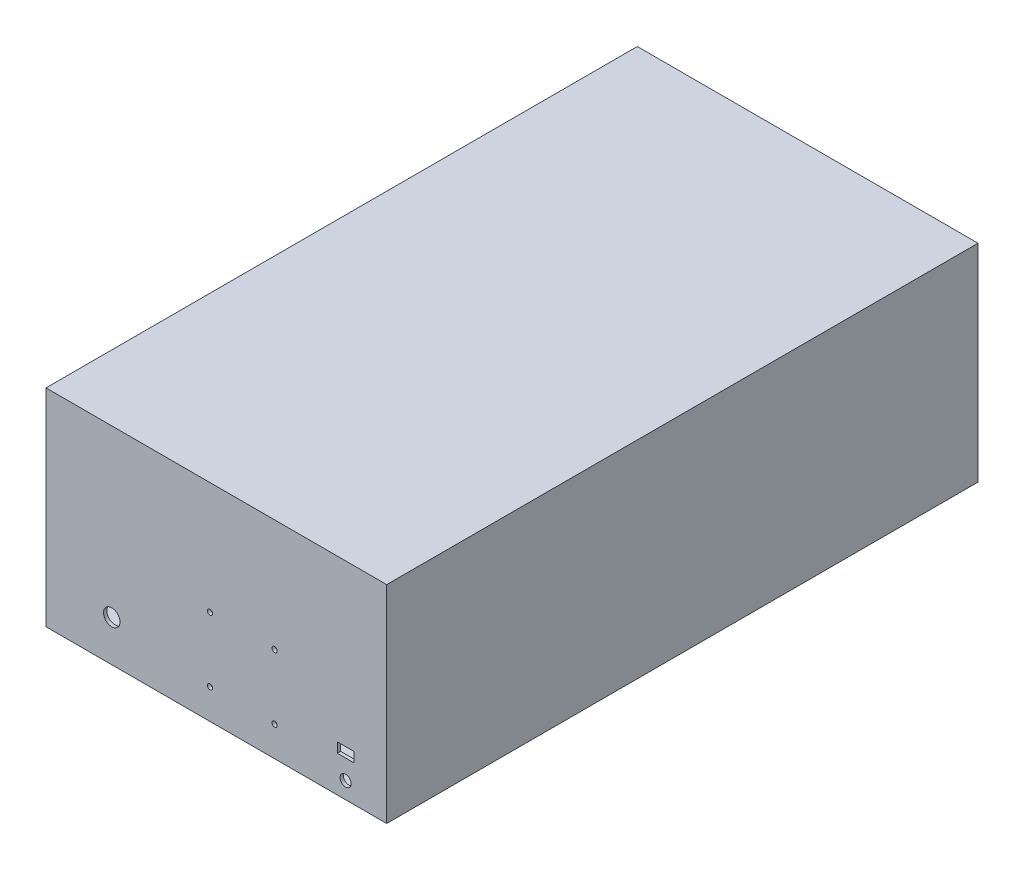
from build123d import *

# Parameters (mm, degrees)
SKETCH2_W               = 207.2
SKETCH2_H               = 359.6
SKETCH2_W_2             = 203.2
SKETCH2_H_2             = 355.6
WALLS_DEPTH             = 123.825
SKETCH3_W               = 207.2
SKETCH3_H               = 359.6
BASE_DEPTH              = 2
SKETCH4_R               = 5
SKETCH4_W               = 10
SKETCH4_H               = 6
CUT_EXTRUDE1_DEPTH      = 395.179845534
SKETCH5_R               = 3.3782
CUT_EXTRUDE2_DEPTH      = 395.179845534
F_1_4_CLEARANCE_HOLE1_D = 6.7564
CUT_EXTRUDE3_REACH      = 244.679
SKETCH9_R               = 1.6
CUT_EXTRUDE4_REACH      = 396.18
SKETCH10_R              = 1.6
SKETCH11_W              = 207.2
SKETCH11_H              = 359.6
BOSS_EXTRUDE1_DEPTH     = 10


with BuildPart() as part:
    # Sketch2 → Walls (new body)
    with BuildSketch(Plane(origin=(0, 0, 0), x_dir=(1, 0, 0), z_dir=(0, 1, 0))):
        Rectangle(SKETCH2_W, SKETCH2_H)
        Rectangle(SKETCH2_W_2, SKETCH2_H_2, mode=Mode.SUBTRACT)
    extrude(amount=WALLS_DEPTH)

    # Sketch3 → Base (add)
    with BuildSketch(Plane.XZ):
        Rectangle(SKETCH3_W, SKETCH3_H)
    extrude(amount=BASE_DEPTH)

    # Sketch4 → Cut-Extrude1 (cut, through all)
    with BuildSketch(Plane(origin=(0, 0, -179.8), x_dir=(-1, 0, 0), z_dir=(0, 0, -1))):
        with Locations((63.6, 23)):
            Circle(SKETCH4_R)
        with Locations((-78.6, 23)):
            Rectangle(SKETCH4_W, SKETCH4_H)
    extrude(amount=-CUT_EXTRUDE1_DEPTH, mode=Mode.SUBTRACT)

    # Sketch5 → Cut-Extrude2 (cut, through all)
    with BuildSketch(Plane(origin=(0, 0, -179.8), x_dir=(-1, 0, 0), z_dir=(0, 0, -1))):
        with Locations((-78.6, 8.09625)):
            Circle(SKETCH5_R)
    extrude(amount=-CUT_EXTRUDE2_DEPTH, mode=Mode.SUBTRACT)

    # 1/4 Clearance Hole1 (through all)
    with Locations(Plane(origin=(0, -2, 0), x_dir=(-1, 0, 0), z_dir=(0, -1, 0))):
        with Locations((-27, 0), (-5, 0)):
            Hole(F_1_4_CLEARANCE_HOLE1_D / 2)

    # Sketch9 → Cut-Extrude3 (cut, up to next)
    with BuildSketch(Plane.XZ.offset(2), mode=Mode.PRIVATE) as cut_extrude3_sk1:
        with Locations((92, 61.675)):
            Circle(SKETCH9_R)
    cut_extrude3_tool1 = extrude(cut_extrude3_sk1.sketch, amount=-CUT_EXTRUDE3_REACH, mode=Mode.PRIVATE) & part.part
    # Sketch9 → Cut-Extrude3 (cut, up to next)
    with BuildSketch(Plane.XZ.offset(2), mode=Mode.PRIVATE) as cut_extrude3_sk2:
        with Locations((92, -61.675)):
            Circle(SKETCH9_R)
    cut_extrude3_tool2 = extrude(cut_extrude3_sk2.sketch, amount=-CUT_EXTRUDE3_REACH, mode=Mode.PRIVATE) & part.part
    # Sketch9 → Cut-Extrude3 (cut, up to next)
    with BuildSketch(Plane.XZ.offset(2), mode=Mode.PRIVATE) as cut_extrude3_sk3:
        with Locations((49, 61.675)):
            Circle(SKETCH9_R)
    cut_extrude3_tool3 = extrude(cut_extrude3_sk3.sketch, amount=-CUT_EXTRUDE3_REACH, mode=Mode.PRIVATE) & part.part
    # Sketch9 → Cut-Extrude3 (cut, up to next)
    with BuildSketch(Plane.XZ.offset(2), mode=Mode.PRIVATE) as cut_extrude3_sk4:
        with Locations((49, -61.675)):
            Circle(SKETCH9_R)
    cut_extrude3_tool4 = extrude(cut_extrude3_sk4.sketch, amount=-CUT_EXTRUDE3_REACH, mode=Mode.PRIVATE) & part.part
    # Sketch9 → Cut-Extrude3 (cut, up to next)
    with BuildSketch(Plane.XZ.offset(2), mode=Mode.PRIVATE) as cut_extrude3_sk5:
        with Locations((27.150599532, -126.77942842)):
            Circle(SKETCH9_R)
    cut_extrude3_tool5 = extrude(cut_extrude3_sk5.sketch, amount=-CUT_EXTRUDE3_REACH, mode=Mode.PRIVATE) & part.part
    # Sketch9 → Cut-Extrude3 (cut, up to next)
    with BuildSketch(Plane.XZ.offset(2), mode=Mode.PRIVATE) as cut_extrude3_sk6:
        with Locations((27.150599532, -166.07942842)):
            Circle(SKETCH9_R)
    cut_extrude3_tool6 = extrude(cut_extrude3_sk6.sketch, amount=-CUT_EXTRUDE3_REACH, mode=Mode.PRIVATE) & part.part
    # Sketch9 → Cut-Extrude3 (cut, up to next)
    with BuildSketch(Plane.XZ.offset(2), mode=Mode.PRIVATE) as cut_extrude3_sk7:
        with Locations((-12.149400468, -126.77942842)):
            Circle(SKETCH9_R)
    cut_extrude3_tool7 = extrude(cut_extrude3_sk7.sketch, amount=-CUT_EXTRUDE3_REACH, mode=Mode.PRIVATE) & part.part
    # Sketch9 → Cut-Extrude3 (cut, up to next)
    with BuildSketch(Plane.XZ.offset(2), mode=Mode.PRIVATE) as cut_extrude3_sk8:
        with Locations((-12.149400468, -166.07942842)):
            Circle(SKETCH9_R)
    cut_extrude3_tool8 = extrude(cut_extrude3_sk8.sketch, amount=-CUT_EXTRUDE3_REACH, mode=Mode.PRIVATE) & part.part
    # Sketch9 → Cut-Extrude3 (cut, up to next)
    with BuildSketch(Plane.XZ.offset(2), mode=Mode.PRIVATE) as cut_extrude3_sk9:
        with Locations((23.972842929, -62.905516645)):
            Circle(SKETCH9_R)
    cut_extrude3_tool9 = extrude(cut_extrude3_sk9.sketch, amount=-CUT_EXTRUDE3_REACH, mode=Mode.PRIVATE) & part.part
    # Sketch9 → Cut-Extrude3 (cut, up to next)
    with BuildSketch(Plane.XZ.offset(2), mode=Mode.PRIVATE) as cut_extrude3_sk10:
        with Locations((23.972842929, -83.205516645)):
            Circle(SKETCH9_R)
    cut_extrude3_tool10 = extrude(cut_extrude3_sk10.sketch, amount=-CUT_EXTRUDE3_REACH, mode=Mode.PRIVATE) & part.part
    # Sketch9 → Cut-Extrude3 (cut, up to next)
    with BuildSketch(Plane.XZ.offset(2), mode=Mode.PRIVATE) as cut_extrude3_sk11:
        with Locations((3.672842929, -62.905516645)):
            Circle(SKETCH9_R)
    cut_extrude3_tool11 = extrude(cut_extrude3_sk11.sketch, amount=-CUT_EXTRUDE3_REACH, mode=Mode.PRIVATE) & part.part
    # Sketch9 → Cut-Extrude3 (cut, up to next)
    with BuildSketch(Plane.XZ.offset(2), mode=Mode.PRIVATE) as cut_extrude3_sk12:
        with Locations((3.672842929, -83.205516645)):
            Circle(SKETCH9_R)
    cut_extrude3_tool12 = extrude(cut_extrude3_sk12.sketch, amount=-CUT_EXTRUDE3_REACH, mode=Mode.PRIVATE) & part.part
    # Sketch9 → Cut-Extrude3 (cut, up to next)
    with BuildSketch(Plane.XZ.offset(2), mode=Mode.PRIVATE) as cut_extrude3_sk13:
        with Locations((-12.790807995, 29.507114508)):
            Circle(SKETCH9_R)
    cut_extrude3_tool13 = extrude(cut_extrude3_sk13.sketch, amount=-CUT_EXTRUDE3_REACH, mode=Mode.PRIVATE) & part.part
    # Sketch9 → Cut-Extrude3 (cut, up to next)
    with BuildSketch(Plane.XZ.offset(2), mode=Mode.PRIVATE) as cut_extrude3_sk14:
        with Locations((-12.790807995, -28.492885492)):
            Circle(SKETCH9_R)
    cut_extrude3_tool14 = extrude(cut_extrude3_sk14.sketch, amount=-CUT_EXTRUDE3_REACH, mode=Mode.PRIVATE) & part.part
    # Sketch9 → Cut-Extrude3 (cut, up to next)
    with BuildSketch(Plane.XZ.offset(2), mode=Mode.PRIVATE) as cut_extrude3_sk15:
        with Locations((-61.790807995, -28.492885492)):
            Circle(SKETCH9_R)
    cut_extrude3_tool15 = extrude(cut_extrude3_sk15.sketch, amount=-CUT_EXTRUDE3_REACH, mode=Mode.PRIVATE) & part.part
    # Sketch9 → Cut-Extrude3 (cut, up to next)
    with BuildSketch(Plane.XZ.offset(2), mode=Mode.PRIVATE) as cut_extrude3_sk16:
        with Locations((-61.790807995, 29.507114508)):
            Circle(SKETCH9_R)
    cut_extrude3_tool16 = extrude(cut_extrude3_sk16.sketch, amount=-CUT_EXTRUDE3_REACH, mode=Mode.PRIVATE) & part.part
    # Sketch9 → Cut-Extrude3 (cut, up to next)
    with BuildSketch(Plane.XZ.offset(2), mode=Mode.PRIVATE) as cut_extrude3_sk17:
        with Locations((-51.497087804, 74.997613979)):
            Circle(SKETCH9_R)
    cut_extrude3_tool17 = extrude(cut_extrude3_sk17.sketch, amount=-CUT_EXTRUDE3_REACH, mode=Mode.PRIVATE) & part.part
    # Sketch9 → Cut-Extrude3 (cut, up to next)
    with BuildSketch(Plane.XZ.offset(2), mode=Mode.PRIVATE) as cut_extrude3_sk18:
        with Locations((-12.197087804, 74.997613979)):
            Circle(SKETCH9_R)
    cut_extrude3_tool18 = extrude(cut_extrude3_sk18.sketch, amount=-CUT_EXTRUDE3_REACH, mode=Mode.PRIVATE) & part.part
    # Sketch9 → Cut-Extrude3 (cut, up to next)
    with BuildSketch(Plane.XZ.offset(2), mode=Mode.PRIVATE) as cut_extrude3_sk19:
        with Locations((-12.197087804, 114.297613979)):
            Circle(SKETCH9_R)
    cut_extrude3_tool19 = extrude(cut_extrude3_sk19.sketch, amount=-CUT_EXTRUDE3_REACH, mode=Mode.PRIVATE) & part.part
    # Sketch9 → Cut-Extrude3 (cut, up to next)
    with BuildSketch(Plane.XZ.offset(2), mode=Mode.PRIVATE) as cut_extrude3_sk20:
        with Locations((-51.497087804, 114.297613979)):
            Circle(SKETCH9_R)
    cut_extrude3_tool20 = extrude(cut_extrude3_sk20.sketch, amount=-CUT_EXTRUDE3_REACH, mode=Mode.PRIVATE) & part.part
    add(cut_extrude3_tool1.solids().sort_by_distance((92, -2, 61.675))[0], mode=Mode.SUBTRACT)
    add(cut_extrude3_tool2.solids().sort_by_distance((92, -2, -61.675))[0], mode=Mode.SUBTRACT)
    add(cut_extrude3_tool3.solids().sort_by_distance((49, -2, 61.675))[0], mode=Mode.SUBTRACT)
    add(cut_extrude3_tool4.solids().sort_by_distance((49, -2, -61.675))[0], mode=Mode.SUBTRACT)
    add(cut_extrude3_tool5.solids().sort_by_distance((27.1506, -2, -126.779428))[0], mode=Mode.SUBTRACT)
    add(cut_extrude3_tool6.solids().sort_by_distance((27.1506, -2, -166.079428))[0], mode=Mode.SUBTRACT)
    add(cut_extrude3_tool7.solids().sort_by_distance((-12.1494, -2, -126.779428))[0], mode=Mode.SUBTRACT)
    add(cut_extrude3_tool8.solids().sort_by_distance((-12.1494, -2, -166.079428))[0], mode=Mode.SUBTRACT)
    add(cut_extrude3_tool9.solids().sort_by_distance((23.972843, -2, -62.905517))[0], mode=Mode.SUBTRACT)
    add(cut_extrude3_tool10.solids().sort_by_distance((23.972843, -2, -83.205517))[0], mode=Mode.SUBTRACT)
    add(cut_extrude3_tool11.solids().sort_by_distance((3.672843, -2, -62.905517))[0], mode=Mode.SUBTRACT)
    add(cut_extrude3_tool12.solids().sort_by_distance((3.672843, -2, -83.205517))[0], mode=Mode.SUBTRACT)
    add(cut_extrude3_tool13.solids().sort_by_distance((-12.790808, -2, 29.507115))[0], mode=Mode.SUBTRACT)
    add(cut_extrude3_tool14.solids().sort_by_distance((-12.790808, -2, -28.492885))[0], mode=Mode.SUBTRACT)
    add(cut_extrude3_tool15.solids().sort_by_distance((-61.790808, -2, -28.492885))[0], mode=Mode.SUBTRACT)
    add(cut_extrude3_tool16.solids().sort_by_distance((-61.790808, -2, 29.507115))[0], mode=Mode.SUBTRACT)
    add(cut_extrude3_tool17.solids().sort_by_distance((-51.497088, -2, 74.997614))[0], mode=Mode.SUBTRACT)
    add(cut_extrude3_tool18.solids().sort_by_distance((-12.197088, -2, 74.997614))[0], mode=Mode.SUBTRACT)
    add(cut_extrude3_tool19.solids().sort_by_distance((-12.197088, -2, 114.297614))[0], mode=Mode.SUBTRACT)
    add(cut_extrude3_tool20.solids().sort_by_distance((-51.497088, -2, 114.297614))[0], mode=Mode.SUBTRACT)

    # Sketch10 → Cut-Extrude4 (cut, up to next)
    with BuildSketch(Plane.XY.offset(179.8), mode=Mode.PRIVATE) as cut_extrude4_sk1:
        with Locations((-3.883568738, 55.54507545)):
            Circle(SKETCH10_R)
    cut_extrude4_tool1 = extrude(cut_extrude4_sk1.sketch, amount=-CUT_EXTRUDE4_REACH, mode=Mode.PRIVATE) & part.part
    # Sketch10 → Cut-Extrude4 (cut, up to next)
    with BuildSketch(Plane.XY.offset(179.8), mode=Mode.PRIVATE) as cut_extrude4_sk2:
        with Locations((35.416431262, 55.54507545)):
            Circle(SKETCH10_R)
    cut_extrude4_tool2 = extrude(cut_extrude4_sk2.sketch, amount=-CUT_EXTRUDE4_REACH, mode=Mode.PRIVATE) & part.part
    # Sketch10 → Cut-Extrude4 (cut, up to next)
    with BuildSketch(Plane.XY.offset(179.8), mode=Mode.PRIVATE) as cut_extrude4_sk3:
        with Locations((35.416431262, 16.24507545)):
            Circle(SKETCH10_R)
    cut_extrude4_tool3 = extrude(cut_extrude4_sk3.sketch, amount=-CUT_EXTRUDE4_REACH, mode=Mode.PRIVATE) & part.part
    # Sketch10 → Cut-Extrude4 (cut, up to next)
    with BuildSketch(Plane.XY.offset(179.8), mode=Mode.PRIVATE) as cut_extrude4_sk4:
        with Locations((-3.883568738, 16.24507545)):
            Circle(SKETCH10_R)
    cut_extrude4_tool4 = extrude(cut_extrude4_sk4.sketch, amount=-CUT_EXTRUDE4_REACH, mode=Mode.PRIVATE) & part.part
    add(cut_extrude4_tool1.solids().sort_by_distance((-3.883569, 55.545075, 179.8))[0], mode=Mode.SUBTRACT)
    add(cut_extrude4_tool2.solids().sort_by_distance((35.416431, 55.545075, 179.8))[0], mode=Mode.SUBTRACT)
    add(cut_extrude4_tool3.solids().sort_by_distance((35.416431, 16.245075, 179.8))[0], mode=Mode.SUBTRACT)
    add(cut_extrude4_tool4.solids().sort_by_distance((-3.883569, 16.245075, 179.8))[0], mode=Mode.SUBTRACT)

    # Sketch11 → Boss-Extrude1 (add)
    with BuildSketch(Plane(origin=(0, 123.825, 0), x_dir=(1, 0, 0), z_dir=(0, 1, 0))):
        Rectangle(SKETCH11_W, SKETCH11_H)
    extrude(amount=-BOSS_EXTRUDE1_DEPTH)


solid = part.part
